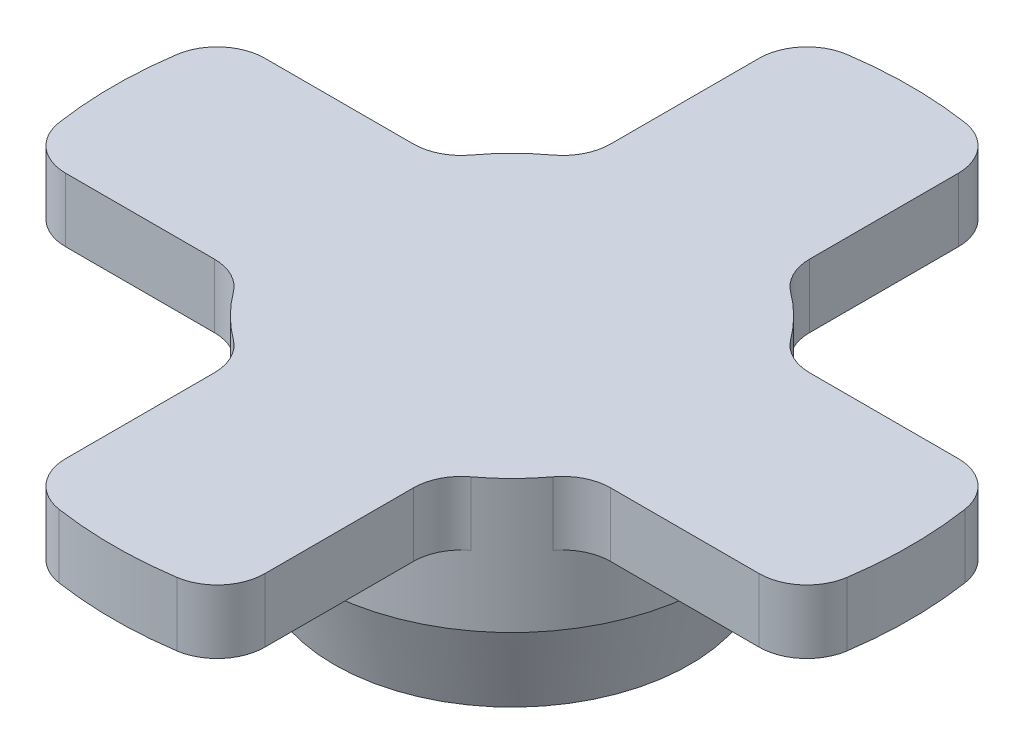
from build123d import *
from OCP.BRepFilletAPI import BRepFilletAPI_MakeChamfer

# Parameters (mm, degrees)
BOSS_EXTRUDE1_DEPTH = 2.032
BOSS_EXTRUDE2_START = -4.762499999999999
SKETCH1_3_R         = 3.4925
BOSS_EXTRUDE2_DEPTH = 4.762499999999999
CHAMFER1_SIZE       = 2.54
CHAMFER1_SIZE2      = 0.6805909487750533
FILLET2_R           = 1.524


with BuildPart() as part:
    # Sketch1 → Boss-Extrude1 (new body)
    with BuildSketch(Plane(origin=(0, 0, 0), x_dir=(1, 0, 0), z_dir=(0, 1, 0))):
        with BuildLine():
            Line((-3.1749999999999994, 12.29672212420855), (-3.175, 5.499261314031185))
            ThreePointArc((-3.1750000000000007, 5.499261314031186), (-4.490128060534577, 4.490128060534578), (-5.499261314031186, 3.1750000000000016))
            Line((-5.499261314031183, 3.1750000000000007), (-12.296722124208548, 3.1750000000000034))
            ThreePointArc((-12.296722124208548, 3.175000000000004), (-12.700000000000001, 1.56e-15), (-12.29672212420855, -3.175000000000001))
            Line((-12.296722124208545, -3.1750000000000003), (-5.499261314031183, -3.175000000000001))
            ThreePointArc((-5.499261314031185, -3.175000000000003), (-4.490128060534575, -4.490128060534579), (-3.174999999999998, -5.499261314031186))
            Line((-3.174999999999998, -5.499261314031185), (-3.1749999999999976, -12.296722124208545))
            ThreePointArc((-3.1750000000000047, -12.296722124208548), (-2.33e-15, -12.700000000000001), (3.175, -12.29672212420855))
            Line((3.175000000000002, -12.296722124208543), (3.175000000000001, -5.499261314031185))
            ThreePointArc((3.175, -5.499261314031186), (4.490128060534578, -4.490128060534577), (5.499261314031187, -3.1749999999999994))
            Line((5.499261314031186, -3.1749999999999985), (12.296722124208548, -3.1749999999999954))
            ThreePointArc((12.296722124208552, -3.174999999999996), (12.700000000000003, 4.44e-15), (12.296722124208548, 3.1750000000000043))
            Line((12.296722124208546, 3.1750000000000043), (5.499261314031185, 3.1750000000000007))
            ThreePointArc((5.499261314031187, 3.175), (4.490128060534579, 4.490128060534575), (3.1749999999999994, 5.499261314031187))
            Line((3.1749999999999994, 5.499261314031186), (3.175, 12.296722124208548))
            ThreePointArc((3.1750000000000003, 12.29672212420855), (8.9e-16, 12.700000000000001), (-3.1749999999999985, 12.29672212420855))
        make_face()
    extrude(amount=BOSS_EXTRUDE1_DEPTH)

    # Sketch1<3> → Boss-Extrude2 (add)
    with BuildSketch(Plane(origin=(0, 0, 0), x_dir=(1, 0, 0), z_dir=(0, 1, 0)).offset(BOSS_EXTRUDE2_START)):
        with BuildLine():
            ThreePointArc((3.174999999999999, 5.499261314031186), (-1.02e-15, 6.35), (-3.175000000000001, 5.499261314031184))
            ThreePointArc((-3.175000000000001, 5.499261314031184), (-4.490128060534576, 4.490128060534577), (-5.499261314031184, 3.175000000000002))
            ThreePointArc((-5.499261314031184, 3.175000000000002), (-6.35, 7.8e-16), (-5.499261314031185, -3.1750000000000007))
            ThreePointArc((-5.499261314031185, -3.1750000000000007), (-4.490128060534575, -4.490128060534578), (-3.174999999999997, -5.499261314031187))
            ThreePointArc((-3.174999999999997, -5.499261314031187), (-1.17e-15, -6.35), (3.1750000000000007, -5.499261314031185))
            ThreePointArc((3.1750000000000007, -5.499261314031185), (4.4901280605345795, -4.490128060534573), (5.499261314031187, -3.1749999999999976))
            ThreePointArc((5.499261314031187, -3.1749999999999976), (6.133628996935584, -1.6435009364010063), (6.35, -1.56e-15))
            ThreePointArc((6.35, 0), (6.133628996935584, 1.6435009364010074), (5.499261314031185, 3.1750000000000007))
            ThreePointArc((5.499261314031185, 3.1750000000000007), (4.490128060534575, 4.490128060534578), (3.174999999999999, 5.499261314031186))
        make_face()
        with Locations(Location((0, 0, 0), (0, 0, 270))):
            Circle(SKETCH1_3_R, mode=Mode.SUBTRACT)
    extrude(amount=BOSS_EXTRUDE2_DEPTH)

    # Chamfer1: one chamfer whose edges measure the first distance from different faces: ONE call of the kernel's chamfer builder (chamfer() names one face for all edges)
    chamfer1_edges_1 = [part.edges().sort_by_distance(p)[0] for p in [
        (3.174999999999999, -4.762499999999999, -5.499261314031194),
    ]]
    chamfer1_side_1 = [part.faces().sort_by_distance(p)[0] for p in [
        (3.1749999999999865, -2.3812499999999996, -5.499261314031195),
    ]]
    chamfer1_edges_2 = [part.edges().sort_by_distance(p)[0] for p in [
        (1.07e-15, -4.762499999999999, -3.4925),
    ]]
    chamfer1_side_2 = [part.faces().sort_by_distance(p)[0] for p in [
        (1.07e-15, -2.3812499999999996, -3.4925),
    ]]
    chamfer1 = BRepFilletAPI_MakeChamfer(part.part.solid().wrapped)
    for e in chamfer1_edges_1:
        chamfer1.Add(CHAMFER1_SIZE, CHAMFER1_SIZE2, e.wrapped, chamfer1_side_1[0].wrapped)  # the first distance lies on this face
    for e in chamfer1_edges_2:
        chamfer1.Add(CHAMFER1_SIZE, CHAMFER1_SIZE2, e.wrapped, chamfer1_side_2[0].wrapped)  # the first distance lies on this face
    add(Compound.cast(chamfer1.Shape()), mode=Mode.REPLACE)

    # Fillet2
    # the kernel refuses this fillet: 1.524 mm, written as the material it adds along each edge
    with BuildSketch(Plane(origin=(3.174999999999999, 0, -5.499261314031187), x_dir=(0.8356194334098629, 0, 0.5493088043239246), z_dir=(0, 1, 0))) as fillet2_piece_1:
        with BuildLine():
            CenterArc((0.8236501414377086, 1.521442818511674), FILLET2_R, 213.31960697214814, 53.3607860557035)
            Line((-0.44983387507892303, 0.6842962007220136), (0, 0))
            ThreePointArc((0, 0), (0.3677009559989754, 0.01065492286802284), (0.7354019119979511, -2e-17))
        make_face()
    extrude(amount=2.032)
    with BuildSketch(Plane(origin=(5.499261314031186, 0, -3.1750000000000007), x_dir=(-0.5493088043239264, 0, -0.8356194334098619), z_dir=(0, 1, 0))) as fillet2_piece_2:
        with BuildLine():
            CenterArc((0.8236501414377053, -1.5214428185116746), FILLET2_R, 93.31960697214826, 53.360786055703514)
            Line((-0.4498338750789252, -0.6842962007220122), (0, 0))
            ThreePointArc((0, 0), (0.36770095599897556, -0.01065492286802262), (0.7354019119979507, -5e-17))
        make_face()
    extrude(amount=2.032)
    with BuildSketch(Plane(origin=(5.499261314031186, 0, 3.174999999999999), x_dir=(-0.5493088043238707, 0, 0.8356194334098983), z_dir=(0, 1, 0))) as fillet2_piece_3:
        with BuildLine():
            CenterArc((0.82365014143777, 1.5214428185116702), FILLET2_R, 213.31960697214453, 53.36078605570418)
            Line((-0.44983387507891454, 0.6842962007220903), (0, 0))
            ThreePointArc((0, 0), (0.36770095599897146, 0.0106549228680418), (0.7354019119979344, 0))
        make_face()
    extrude(amount=2.032)
    with BuildSketch(Plane(origin=(3.1750000000000007, 0, 5.499261314031186), x_dir=(0.8356194334099104, 0, -0.5493088043238523), z_dir=(0, 1, 0))) as fillet2_piece_4:
        with BuildLine():
            CenterArc((0.8236501414377962, -1.5214428185116662), FILLET2_R, 93.31960697215332, 53.360786055703485)
            Line((-0.44983387507890776, -0.684296200722116), (0, 0))
            ThreePointArc((0, 0), (0.3677009559989559, -0.01065492286805522), (0.7354019119979073, 0))
        make_face()
    extrude(amount=2.032)
    with BuildSketch(Plane(origin=(-3.1749999999999976, 0, 5.499261314031186), x_dir=(-0.8356194334099473, 0, -0.5493088043237963), z_dir=(0, 1, 0))) as fillet2_piece_5:
        with BuildLine():
            CenterArc((0.8236501414378631, 1.5214428185116622), FILLET2_R, 213.31960697213952, 53.36078605570407)
            Line((-0.44983387507889466, 0.6842962007221938), (0, 0))
            ThreePointArc((0, 0), (0.3677009559989472, 0.01065492286807322), (0.7354019119978917, 3e-17))
        make_face()
    extrude(amount=2.032)
    with BuildSketch(Plane(origin=(-5.499261314031184, 0, 3.1750000000000025), x_dir=(0.5493088043237985, 0, 0.8356194334099457), z_dir=(0, 1, 0))) as fillet2_piece_6:
        with BuildLine():
            CenterArc((0.823650141437862, -1.521442818511662), FILLET2_R, 93.31960697215631, 53.36078605570414)
            Line((-0.44983387507889533, -0.6842962007221932), (0, 0))
            ThreePointArc((0, 0), (0.36770095599894603, -0.01065492286807348), (0.7354019119978936, -3e-17))
        make_face()
    extrude(amount=2.032)
    with BuildSketch(Plane(origin=(-5.499261314031185, 0, -3.1750000000000016), x_dir=(0.5493088043238532, 0, -0.8356194334099099), z_dir=(0, 1, 0))) as fillet2_piece_7:
        with BuildLine():
            CenterArc((0.8236501414377951, 1.5214428185116664), FILLET2_R, 213.3196069721432, 53.36078605570356)
            Line((-0.44983387507890893, 0.6842962007221164), (0, 0))
            ThreePointArc((0, 0), (0.3677009559989552, 0.01065492286805513), (0.7354019119979077, 3e-17))
        make_face()
    extrude(amount=2.032)
    with BuildSketch(Plane(origin=(-3.1750000000000007, 0, -5.499261314031186), x_dir=(-0.8356194334098974, 0, 0.5493088043238722), z_dir=(0, 1, 0))) as fillet2_piece_8:
        with BuildLine():
            CenterArc((0.8236501414377697, -1.5214428185116697), FILLET2_R, 93.31960697215125, 53.36078605570417)
            Line((-0.44983387507891404, -0.6842962007220886), (0, 0))
            ThreePointArc((0, 0), (0.3677009559989685, -0.01065492286804046), (0.7354019119979357, 0))
        make_face()
    extrude(amount=2.032)
    # the kernel refuses this fillet: 1.524 mm, written as the material it takes off along each edge
    with BuildSketch(Plane(origin=(3.175, -3.313522044377113, -12.29672212420855), x_dir=(-0.9799720802882134, 0, -0.1991349337901098), z_dir=(0, 1, 0))) as fillet2_2_piece_1:
        with BuildLine():
            CenterArc((1.2458842886857948, 1.5219237330684425), FILLET2_R, 191.48637688209308, 81.5047584217437)
            Line((-0.24759316167344236, 1.218442093972315), (0, 0))
            ThreePointArc((0, 0), (0.662704408875422, -0.01730222442965028), (1.325408817750845, 1e-17))
        make_face()
    extrude(amount=8.659044088754227, mode=Mode.SUBTRACT)
    with BuildSketch(Plane(origin=(12.29672212420855, -3.313522044377107, -3.1750000000000043), x_dir=(-1, 0, 3.6e-16), z_dir=(0, 1, 0))) as fillet2_2_piece_2:
        with BuildLine():
            CenterArc((1.2433436813975, 1.524), FILLET2_R, 188.49524157825633, 81.50475842174365)
            ThreePointArc((-0.2639351971676436, 1.2988636363636346), (-0.14892329545175875, 0.6459863408655977), (0, 0))
            Line((0, 0), (1.2433436813974996, 0))
        make_face()
    extrude(amount=8.659044088754214, mode=Mode.SUBTRACT)
    with BuildSketch(Plane(origin=(12.29672212420855, -3.3135220443771116, 3.1749999999999954), x_dir=(0.19913493379011118, 0, -0.979972080288213), z_dir=(0, 1, 0))) as fillet2_2_piece_3:
        with BuildLine():
            CenterArc((1.2458842886857922, 1.5219237330684423), FILLET2_R, 191.48637688209323, 81.50475842174365)
            Line((-0.24759316167344428, 1.218442093972311), (0, 0))
            ThreePointArc((0, 0), (0.6627044088754224, -0.0173022244296529), (1.3254088177508445, -3e-17))
        make_face()
    extrude(amount=8.659044088754225, mode=Mode.SUBTRACT)
    with BuildSketch(Plane(origin=(3.1750000000000016, -3.3135220443771147, 12.296722124208548), x_dir=(-0.979972080288213, 0, 0.19913493379011105), z_dir=(0, 1, 0))) as fillet2_2_piece_4:
        with BuildLine():
            CenterArc((1.245884288685793, -1.521923733068442), FILLET2_R, 87.00886469616313, 81.50475842174379)
            Line((-0.24759316167344436, -1.2184420939723146), (0, 0))
            ThreePointArc((0, 0), (0.6627044088754228, 0.0173022244296529), (1.3254088177508452, 4e-17))
        make_face()
    extrude(amount=8.65904408875423, mode=Mode.SUBTRACT)
    with BuildSketch(Plane(origin=(-3.1749999999999976, -3.313522044377123, 12.29672212420855), x_dir=(0, 0, -1), z_dir=(0, 1, 0))) as fillet2_2_piece_5:
        with BuildLine():
            CenterArc((1.2433436813975014, -1.524), FILLET2_R, 90, 81.50475842174376)
            ThreePointArc((-0.26393519716764224, -1.2988636363636372), (-0.14892329545176075, -0.6459863408655981), (0, 0))
            Line((0, 0), (1.2433436813975014, 0))
        make_face()
    extrude(amount=8.659044088754246, mode=Mode.SUBTRACT)
    with BuildSketch(Plane(origin=(-12.29672212420855, -3.313522044377118, 3.1750000000000003), x_dir=(1, 0, 0), z_dir=(0, 1, 0))) as fillet2_2_piece_6:
        with BuildLine():
            CenterArc((1.2433436813975014, 1.524), FILLET2_R, 188.4952415782562, 81.50475842174376)
            ThreePointArc((-0.26393519716764224, 1.298863636363638), (-0.1489232954517643, 0.6459863408655999), (0, 0))
            Line((0, 0), (1.2433436813975014, 0))
        make_face()
    extrude(amount=8.659044088754236, mode=Mode.SUBTRACT)
    with BuildSketch(Plane(origin=(-12.29672212420855, -3.3135220443771147, -3.1750000000000034), x_dir=(-0.1991349337901111, 0, 0.9799720802882133), z_dir=(0, 1, 0))) as fillet2_2_piece_7:
        with BuildLine():
            CenterArc((1.2458842886857935, 1.5219237330684425), FILLET2_R, 191.4863768820932, 81.50475842174365)
            Line((-0.24759316167344286, 1.2184420939723115), (0, 0))
            ThreePointArc((0, 0), (0.662704408875423, -0.01730222442965109), (1.3254088177508456, -2e-17))
        make_face()
    extrude(amount=8.65904408875423, mode=Mode.SUBTRACT)
    with BuildSketch(Plane(origin=(-3.1749999999999994, -3.3135220443771085, -12.296722124208546), x_dir=(0, 0, 1), z_dir=(0, 1, 0))) as fillet2_2_piece_8:
        with BuildLine():
            CenterArc((1.2433436813974978, 1.524), FILLET2_R, 188.4952415782563, 81.5047584217437)
            ThreePointArc((-0.2639351971676458, 1.2988636363636357), (-0.1489232954517643, 0.6459863408655977), (0, 0))
            Line((0, 0), (1.2433436813974978, 0))
        make_face()
    extrude(amount=8.659044088754218, mode=Mode.SUBTRACT)


solid = part.part
